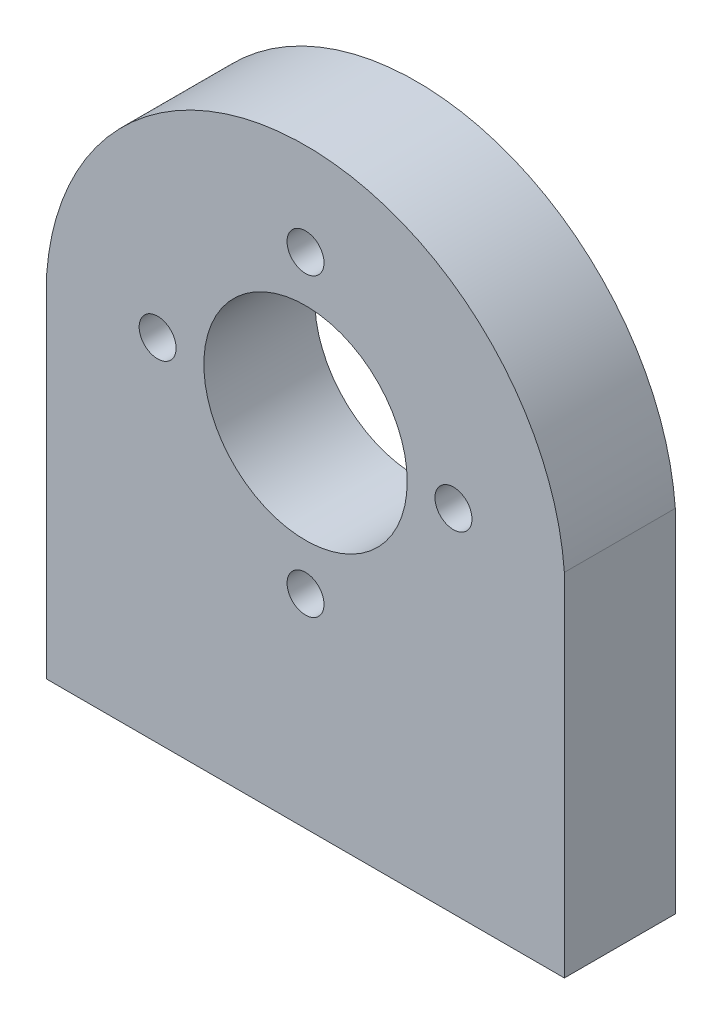
from build123d import *

# Parameters (mm, degrees)
ESQUISSE1_W             = 28
ESQUISSE1_H             = 32
BOSS_EXTRU_1_DEPTH      = 6
ESQUISSE2_R             = 1.25
ENL_V_MAT_EXTRU_1_DEPTH = 10
ESQUISSE3_R             = 5.5
ENL_V_MAT_EXTRU_2_DEPTH = 43.941821107
ESQUISSE4_R             = 1
ENL_V_MAT_EXTRU_4_DEPTH = 43.941821107
ENL_V_MAT_EXTRU_5_DEPTH = 43.941821107


with BuildPart() as part:
    # Esquisse1 → Boss.-Extru.1 (new body)
    with BuildSketch(Plane.XY):
        with Locations((14, 16)):
            Rectangle(ESQUISSE1_W, ESQUISSE1_H)
    extrude(amount=BOSS_EXTRU_1_DEPTH)

    # Esquisse2 → Enlèv. mat.-Extru.1 (cut)
    with BuildSketch(Plane.XZ):
        with Locations((6, 3)):
            Circle(ESQUISSE2_R)
        with Locations((22, 3)):
            Circle(ESQUISSE2_R)
    extrude(amount=-ENL_V_MAT_EXTRU_1_DEPTH, mode=Mode.SUBTRACT)

    # Esquisse3 → Enlèv. mat.-Extru.2 (cut, through all)
    with BuildSketch(Plane.XY.offset(6)):
        with Locations((14, 19)):
            Circle(ESQUISSE3_R)
    extrude(amount=-ENL_V_MAT_EXTRU_2_DEPTH, mode=Mode.SUBTRACT)

    # Esquisse4 → Enlèv. mat.-Extru.4 (cut, through all)
    with BuildSketch(Plane.XY.offset(6)):
        with Locations((14, 11)):
            Circle(ESQUISSE4_R)
        with Locations((6, 19)):
            Circle(ESQUISSE4_R)
        with Locations((14, 27)):
            Circle(ESQUISSE4_R)
        with Locations((22, 19)):
            Circle(ESQUISSE4_R)
    extrude(amount=-ENL_V_MAT_EXTRU_4_DEPTH, mode=Mode.SUBTRACT)

    # Esquisse5 → Enlèv. mat.-Extru.5 (cut, through all)
    with BuildSketch(Plane.XY.offset(6)):
        with BuildLine():
            Line((0, 19), (0, 33))
            Line((0, 33), (28, 33))
            Line((28, 33), (28, 19))
            ThreePointArc((28, 19), (14, 32), (0, 19))
        make_face()
    extrude(amount=-ENL_V_MAT_EXTRU_5_DEPTH, mode=Mode.SUBTRACT)


solid = part.part
